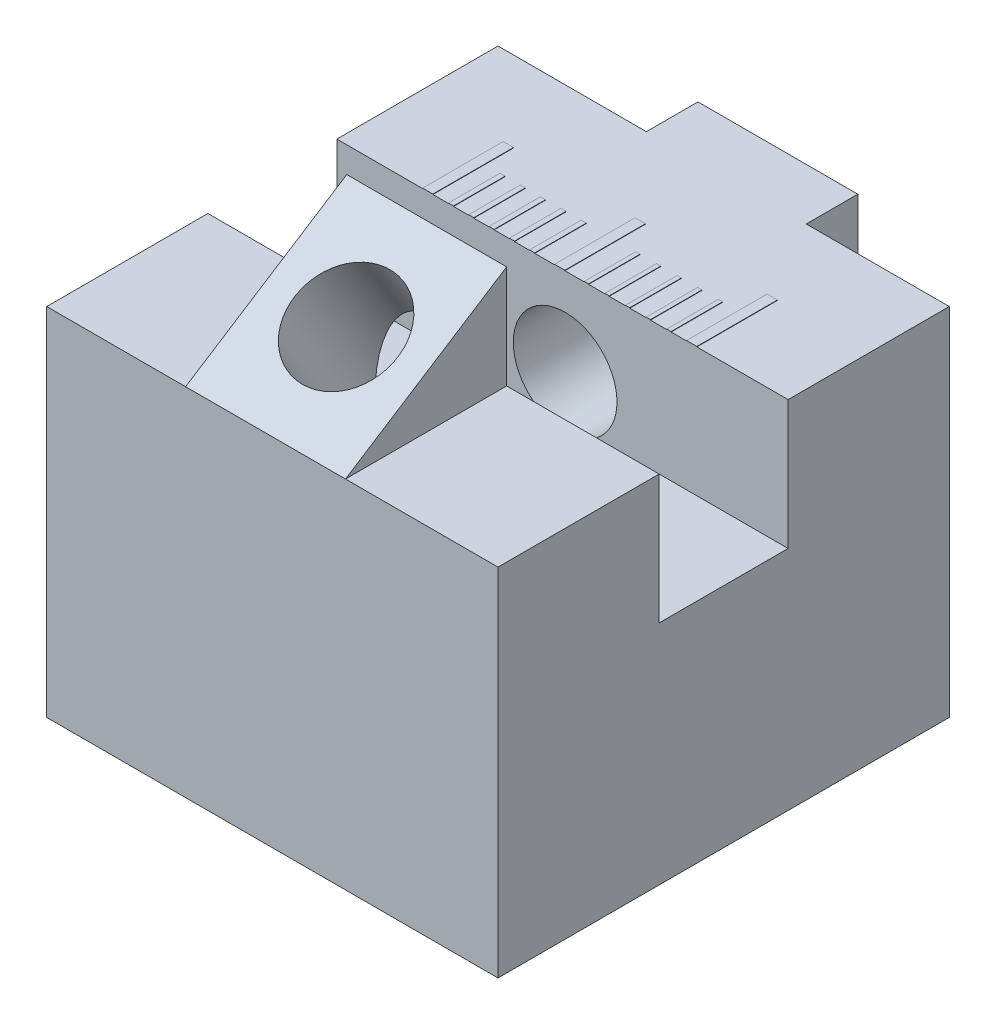
from build123d import *

# Parameters (mm, degrees)
SKETCH1_W                       = 22.225
SKETCH1_H                       = 17.526
BOSS_EXTRUDE1_DEPTH             = 22.225
SKETCH2_W                       = 7.874
SKETCH2_H                       = 17.526
BOSS_EXTRUDE2_DEPTH             = 2.54
SKETCH3_W                       = 22.225
SKETCH3_H                       = 6.35
CUT_EXTRUDE1_DEPTH              = 6.35
SKETCH5_W                       = 7.874
SKETCH5_H                       = 7.9375
BOSS_EXTRUDE3_DEPTH             = 5.08
F_1_4_20_START                  = -13.6525
F_1_4_20_TAPPED_HOLE1_OUTLINE_R = 2.5527
F_1_4_20_TAPPED_HOLE1_DEPTH     = 10.4775
CUT_EXTRUDE3_REACH              = 26.382
F_1_4_20_START_2                = 4.410249561
F_1_4_20_TAPPED_HOLE2_OUTLINE_R = 2.5527
F_1_4_20_TAPPED_HOLE2_DEPTH     = 8.960808925
SKETCH21_W                      = 0.508
SKETCH21_H                      = 3.96875
BOSS_EXTRUDE4_DEPTH             = 0.02
LPATTERN1_COUNT                 = 3
LPATTERN1_PITCH                 = 6.5
SKETCH22_W                      = 0.211811424
SKETCH22_H                      = 2.54
BOSS_EXTRUDE5_DEPTH             = 0.02
LPATTERN2_COUNT                 = 5
LPATTERN2_PITCH                 = 1.016
SKETCH23_W                      = 0.254
SKETCH23_H                      = 2.54
BOSS_EXTRUDE6_DEPTH             = 0.02
LPATTERN3_COUNT                 = 5
LPATTERN3_PITCH                 = 1


# Read off the part's stored shape, not the designer's step: 1/4-20 Tapped Hole1, 1/4-20 Tapped Hole2
with BuildPart() as part:
    # Sketch1 → Boss-Extrude1 (new body)
    with BuildSketch(Plane(origin=(0, 0, 0), x_dir=(0, 0, -1), z_dir=(1, 0, 0))):
        Rectangle(SKETCH1_W, SKETCH1_H)
    extrude(amount=BOSS_EXTRUDE1_DEPTH)

    # Sketch2 → Boss-Extrude2 (add)
    with BuildSketch(Plane(origin=(0, 0, -11.1125), x_dir=(-1, 0, 0), z_dir=(0, 0, -1))):
        with Locations((-11.243689687, 0)):
            Rectangle(SKETCH2_W, SKETCH2_H)
    extrude(amount=BOSS_EXTRUDE2_DEPTH)

    # Sketch3 → Cut-Extrude1 (cut)
    with BuildSketch(Plane(origin=(0, 8.763, 0), x_dir=(1, 0, 0), z_dir=(0, 1, 0))):
        with Locations((11.1125, 0)):
            Rectangle(SKETCH3_W, SKETCH3_H)
    extrude(amount=-CUT_EXTRUDE1_DEPTH, mode=Mode.SUBTRACT)

    # Sketch5 → Boss-Extrude3 (add)
    with BuildSketch(Plane(origin=(0, 8.763, 0), x_dir=(1, 0, 0), z_dir=(0, 1, 0))):
        with Locations((10.776161326, -7.14375)):
            Rectangle(SKETCH5_W, SKETCH5_H)
    extrude(amount=BOSS_EXTRUDE3_DEPTH)

    # 1/4-20 Tapped Hole1 outline → 1/4-20 Tapped Hole1 (cut)
    with BuildSketch(Plane.XY.offset(F_1_4_20_START)):
        with Locations((11.243689687, 4.445)):
            Circle(F_1_4_20_TAPPED_HOLE1_OUTLINE_R)
    extrude(amount=F_1_4_20_TAPPED_HOLE1_DEPTH, mode=Mode.SUBTRACT)

    # Sketch6 → Cut-Extrude3 (cut, up to next)
    with BuildSketch(Plane(origin=(14.713161326, 0, 0), x_dir=(0, 0, -1), z_dir=(1, 0, 0)), mode=Mode.PRIVATE) as cut_extrude3_sk1:
        Polygon((-11.1125, 8.763), (-3.175, 13.843), (-11.1125, 13.843), align=None)
    cut_extrude3_tool1 = extrude(cut_extrude3_sk1.sketch, amount=-CUT_EXTRUDE3_REACH, mode=Mode.PRIVATE) & part.part
    add(cut_extrude3_tool1.solids().sort_by_distance((14.713161, 12.149667, 8.466667))[0], mode=Mode.SUBTRACT)

    # 1/4-20 Tapped Hole2 outline → 1/4-20 Tapped Hole2 (cut)
    with BuildSketch(Plane(origin=(0, 0, 0), x_dir=(1, 0, 0), z_dir=(0, 0.842271400661511, 0.539053696423368)).offset(F_1_4_20_START_2)):
        with Locations((10.779806469, 0.071193023)):
            Circle(F_1_4_20_TAPPED_HOLE2_OUTLINE_R)
    extrude(amount=F_1_4_20_TAPPED_HOLE2_DEPTH, mode=Mode.SUBTRACT)

    # Sketch21 → Boss-Extrude4 (add)
    with BuildSketch(Plane(origin=(0, 8.763, 0), x_dir=(1, 0, 0), z_dir=(0, 1, 0))):
        with Locations((17.4768928, 5.159375)):
            Rectangle(SKETCH21_W, SKETCH21_H)
    boss_extrude4 = extrude(amount=BOSS_EXTRUDE4_DEPTH)

    # LPattern1: Boss-Extrude4 ×3
    with Locations(*[(-i * LPATTERN1_PITCH, 0, 0) for i in range(1, LPATTERN1_COUNT)]):
        add(boss_extrude4)

    # Sketch22 → Boss-Extrude5 (add)
    with BuildSketch(Plane(origin=(0, 8.763, 0), x_dir=(1, 0, 0), z_dir=(0, 1, 0))):
        with Locations((16.354987088, 4.445)):
            Rectangle(SKETCH22_W, SKETCH22_H)
    boss_extrude5 = extrude(amount=BOSS_EXTRUDE5_DEPTH)

    # LPattern2: Boss-Extrude5 ×5
    with Locations(*[(-i * LPATTERN2_PITCH, 0, 0) for i in range(1, LPATTERN2_COUNT)]):
        add(boss_extrude5)

    # Sketch23 → Boss-Extrude6 (add)
    with BuildSketch(Plane(origin=(0, 8.763, 0), x_dir=(1, 0, 0), z_dir=(0, 1, 0))):
        with Locations((5.6198928, 4.445)):
            Rectangle(SKETCH23_W, SKETCH23_H)
    boss_extrude6 = extrude(amount=BOSS_EXTRUDE6_DEPTH)

    # LPattern3: Boss-Extrude6 ×5
    with Locations(*[(i * LPATTERN3_PITCH, 0, 0) for i in range(1, LPATTERN3_COUNT)]):
        add(boss_extrude6)


solid = part.part
